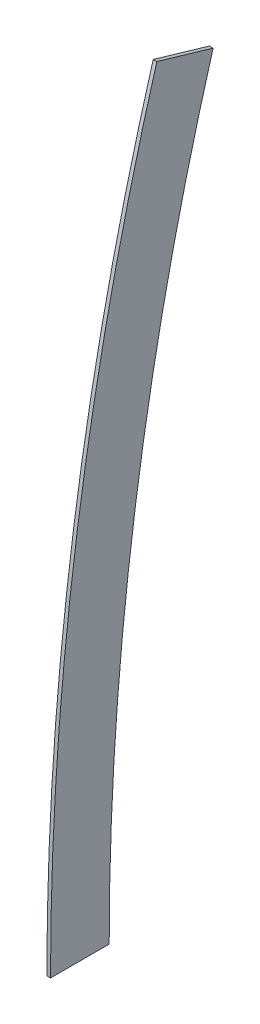
from build123d import *

# Parameters (mm, degrees)
BASE_FLANGE1_DEPTH = 1.5875


# Sheet-metal steps are written as plain solids
with BuildPart() as part:
    # Sketch1 → Base-Flange1 (new body)
    with BuildSketch(Plane(origin=(0, 0, 0), x_dir=(0, 0, -1), z_dir=(1, 0, 0))):
        with BuildLine():
            Line((0, 0), (25.4, 0))
            ThreePointArc((25.4, 0), (36.710297522, 158.371881791), (70.411619342, 313.52921059))
            Line((70.411619342, 313.52921059), (46.0375, 320.675))
            ThreePointArc((46.0375, 320.675), (11.568075749, 161.98140868), (0, 0))
        make_face()
    extrude(amount=-BASE_FLANGE1_DEPTH)


solid = part.part
